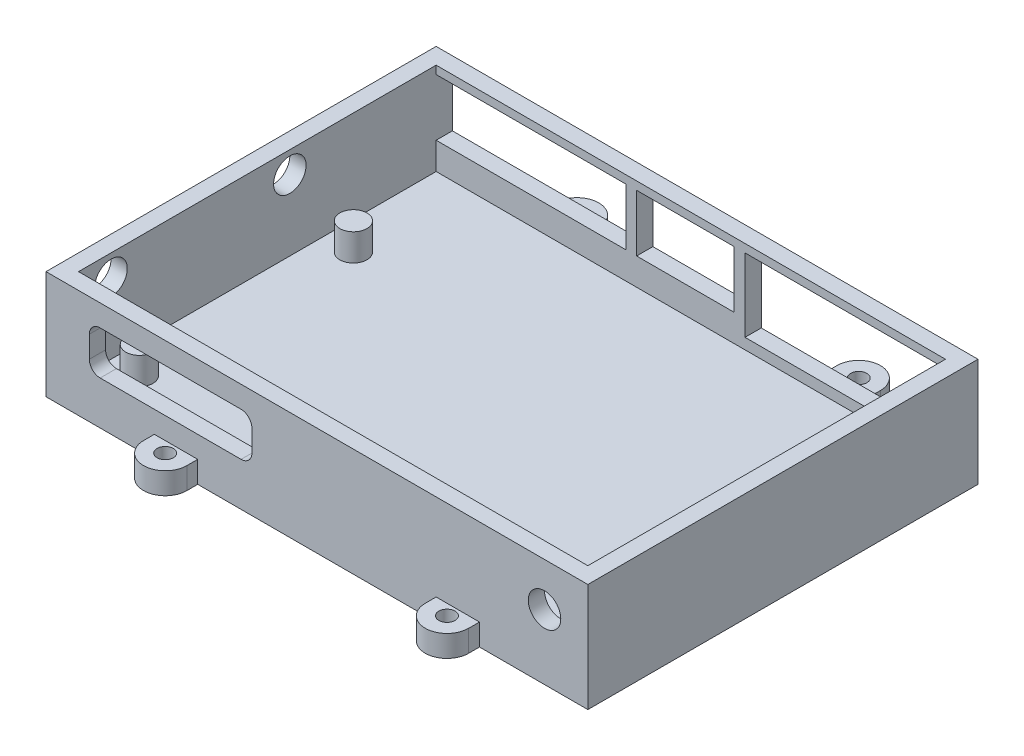
from build123d import *

# Parameters (mm, degrees)
PLATE_W              = 100
PLATE_H              = 72
BOSS_EXTRUDE1_DEPTH  = 20
WALL_W               = 94
WALL_H               = 66
CUT_EXTRUDE1_DEPTH   = 17
MOUNT_COLUMN_R       = 2.5
BOSS_EXTRUDE2_DEPTH  = 5
BACK_SOCKETS_W       = 37
BACK_SOCKETS_H       = 13.5
BACK_SOCKETS_W_2     = 35
BACK_SOCKETS_H_2     = 10.5
BACK_SOCKETS_W_3     = 18
CUT_EXTRUDE2_DEPTH   = 18
CUT_EXTRUDE4_DEPTH   = 18
ANT1_HOLE_R          = 3
CUT_EXTRUDE5_DEPTH   = 10
ANT2_HOLE_R          = 3
CUT_EXTRUDE6_DEPTH   = 10
RESET_HOLE_R         = 3
CUT_EXTRUDE8_DEPTH   = 6
LUG1_R               = 1.5
BOSS_EXTRUDE10_DEPTH = 4
LUG2_R               = 1.5
BOSS_EXTRUDE11_DEPTH = 4
LUG3_R               = 1.5
BOSS_EXTRUDE12_DEPTH = 4
LUG4_R               = 1.5
BOSS_EXTRUDE13_DEPTH = 4


with BuildPart() as part:
    # plate → Boss-Extrude1 (new body)
    with BuildSketch(Plane(origin=(0, 0, 0), x_dir=(1, 0, 0), z_dir=(0, 1, 0))):
        with Locations((0.803212851, 7.285140562)):
            Rectangle(PLATE_W, PLATE_H)
    extrude(amount=BOSS_EXTRUDE1_DEPTH)

    # wall → Cut-Extrude1 (cut)
    with BuildSketch(Plane(origin=(0, 20, 0), x_dir=(1, 0, 0), z_dir=(0, 1, 0))):
        with Locations((0.803212851, 7.285140562)):
            Rectangle(WALL_W, WALL_H)
    extrude(amount=-CUT_EXTRUDE1_DEPTH, mode=Mode.SUBTRACT)

    # mount_column → Boss-Extrude2 (add)
    with BuildSketch(Plane(origin=(0, 3, 0), x_dir=(1, 0, 0), z_dir=(0, 1, 0))):
        with Locations((-40.962789341, -19.714859438)):
            Circle(MOUNT_COLUMN_R)
        with Locations((-40.962789341, 19.785140562)):
            Circle(MOUNT_COLUMN_R)
        with Locations((43.037210659, -17.714859438)):
            Circle(MOUNT_COLUMN_R)
        with Locations((43.037210659, 19.785140562)):
            Circle(MOUNT_COLUMN_R)
    extrude(amount=BOSS_EXTRUDE2_DEPTH)

    # back_sockets → Cut-Extrude2 (cut)
    with BuildSketch(Plane(origin=(0, 0, -43.285140562), x_dir=(-1, 0, 0), z_dir=(0, 0, -1))):
        with Locations((-29.303212851, 11.75)):
            Rectangle(BACK_SOCKETS_W, BACK_SOCKETS_H)
        with Locations((28.696787149, 13.25)):
            Rectangle(BACK_SOCKETS_W_2, BACK_SOCKETS_H_2)
        with Locations((0.196787149, 13.25)):
            Rectangle(BACK_SOCKETS_W_3, BACK_SOCKETS_H_2)
    extrude(amount=-CUT_EXTRUDE2_DEPTH, mode=Mode.SUBTRACT)

    # usb type-c → Cut-Extrude4 (cut)
    with BuildSketch(Plane.XY.offset(28.714859438)):
        with BuildLine():
            Line((-39.196787149, 16), (-13.196787149, 16))
            ThreePointArc((-13.196787149, 16), (-11.782573586, 15.414213562), (-11.196787149, 14))
            Line((-11.196787149, 14), (-11.196787149, 10))
            ThreePointArc((-11.196787149, 10), (-11.782573586, 8.585786438), (-13.196787149, 8))
            Line((-13.196787149, 8), (-39.196787149, 8))
            ThreePointArc((-39.196787149, 8), (-40.611000711, 8.585786438), (-41.196787149, 10))
            Line((-41.196787149, 10), (-41.196787149, 14))
            ThreePointArc((-41.196787149, 14), (-40.611000711, 15.414213562), (-39.196787149, 16))
        make_face()
    extrude(amount=-CUT_EXTRUDE4_DEPTH, mode=Mode.SUBTRACT)

    # ant1-hole → Cut-Extrude5 (cut)
    with BuildSketch(Plane.ZY.offset(49.196787149)):
        with Locations((-13.285140562, 16)):
            Circle(ANT1_HOLE_R)
    extrude(amount=-CUT_EXTRUDE5_DEPTH, mode=Mode.SUBTRACT)

    # ant2-hole → Cut-Extrude6 (cut)
    with BuildSketch(Plane.ZY.offset(49.196787149)):
        with Locations((19.714859438, 16)):
            Circle(ANT2_HOLE_R)
    extrude(amount=-CUT_EXTRUDE6_DEPTH, mode=Mode.SUBTRACT)

    # reset-hole → Cut-Extrude8 (cut)
    with BuildSketch(Plane.XY.offset(28.714859438)):
        with Locations((42.803212851, 12)):
            Circle(RESET_HOLE_R)
    extrude(amount=-CUT_EXTRUDE8_DEPTH, mode=Mode.SUBTRACT)

    # lug1 → Boss-Extrude10 (add)
    with BuildSketch(Plane(origin=(0, 0, 0), x_dir=(1, 0, 0), z_dir=(0, 1, 0))):
        with BuildLine():
            Line((-29.196787149, -28.714859438), (-29.196787149, -30.714859438))
            ThreePointArc((-29.196787149, -30.714859438), (-25.196787149, -34.714859438), (-21.196787149, -30.714859438))
            Line((-21.196787149, -30.714859438), (-21.196787149, -28.714859438))
            Line((-21.196787149, -28.714859438), (-29.196787149, -28.714859438))
        make_face()
        with Locations((-25.196787149, -30.714859438)):
            Circle(LUG1_R, mode=Mode.SUBTRACT)
    extrude(amount=BOSS_EXTRUDE10_DEPTH)

    # lug2 → Boss-Extrude11 (add)
    with BuildSketch(Plane(origin=(0, 0, 0), x_dir=(1, 0, 0), z_dir=(0, 1, 0))):
        with BuildLine():
            Line((22.803212851, -28.714859438), (22.803212851, -30.714859438))
            ThreePointArc((22.803212851, -30.714859438), (26.803212851, -34.714859438), (30.803212851, -30.714859438))
            Line((30.803212851, -30.714859438), (30.803212851, -28.714859438))
            Line((30.803212851, -28.714859438), (22.803212851, -28.714859438))
        make_face()
        with Locations((26.803212851, -30.714859438)):
            Circle(LUG2_R, mode=Mode.SUBTRACT)
    extrude(amount=BOSS_EXTRUDE11_DEPTH)

    # lug3 → Boss-Extrude12 (add)
    with BuildSketch(Plane(origin=(0, 0, 0), x_dir=(1, 0, 0), z_dir=(0, 1, 0))):
        with BuildLine():
            Line((30.803212851, 43.270916449), (30.803212851, 45.270916449))
            ThreePointArc((30.803212851, 45.270916449), (26.803212851, 49.270916449), (22.803212851, 45.270916449))
            Line((22.803212851, 45.270916449), (22.803212851, 43.270916449))
            Line((22.803212851, 43.270916449), (30.803212851, 43.270916449))
        make_face()
        with Locations((26.803212851, 45.270916449)):
            Circle(LUG3_R, mode=Mode.SUBTRACT)
    extrude(amount=BOSS_EXTRUDE12_DEPTH)

    # lug4 → Boss-Extrude13 (add)
    with BuildSketch(Plane(origin=(0, 0, 0), x_dir=(1, 0, 0), z_dir=(0, 1, 0))):
        with BuildLine():
            Line((-21.196787149, 43.285140562), (-21.196787149, 45.285140562))
            ThreePointArc((-21.196787149, 45.285140562), (-25.196787149, 49.285140562), (-29.196787149, 45.285140562))
            Line((-29.196787149, 45.285140562), (-29.196787149, 43.285140562))
            Line((-29.196787149, 43.285140562), (-21.196787149, 43.285140562))
        make_face()
        with Locations((-25.196787149, 45.285140562)):
            Circle(LUG4_R, mode=Mode.SUBTRACT)
    extrude(amount=BOSS_EXTRUDE13_DEPTH)


solid = part.part
